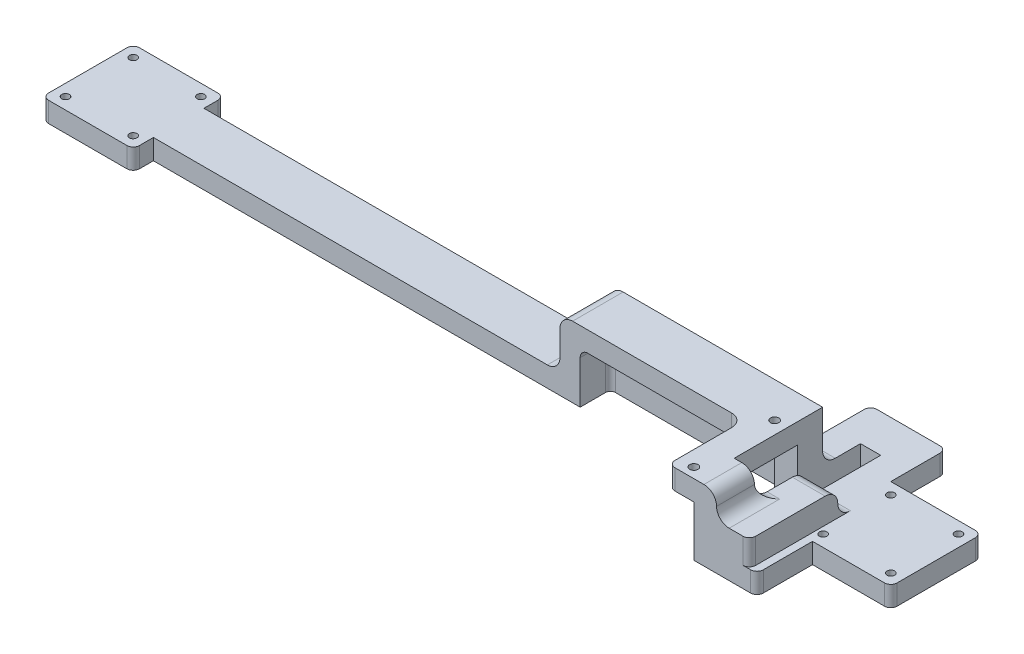
from build123d import *

# Parameters (mm, degrees)
SKETCH1_W            = 70
SKETCH1_H            = 20
SKETCH1_W_2          = 264.8
EXTRUDE_1017_DEPTH   = 8
SKETCH2_W            = 36
SKETCH2_H            = 8
BOSS_EXTRUDE2_DEPTH  = 8
SKETCH4_W            = 36
SKETCH4_H            = 8
BOSS_EXTRUDE3_DEPTH  = 8
SKETCH5_R            = 1.5
CUT_EXTRUDE1_DEPTH   = 349.438631613
FILLET1_R            = 2.5
SKETCH6_W            = 52
SKETCH6_H            = 20
CUT_EXTRUDE2_DEPTH   = 349.438631613
SKETCH7_W            = 16.8
SKETCH7_H            = 20
CUT_EXTRUDE3_DEPTH   = 299.821485171
SKETCH8_W            = 30
SKETCH8_H            = 8
BOSS_EXTRUDE4_DEPTH  = 30
SKETCH9_W            = 30
SKETCH9_H            = 8
BOSS_EXTRUDE5_DEPTH  = 30
SKETCH10_W           = 8
SKETCH10_H           = 50
CUT_EXTRUDE4_DEPTH   = 307.61226329
SKETCH12_W           = 11
SKETCH12_H           = 50
BOSS_EXTRUDE6_DEPTH  = 17
SKETCH13_W           = 8
SKETCH13_H           = 15
BOSS_EXTRUDE7_DEPTH  = 17
SKETCH15_W           = 11
SKETCH15_H           = 45
CUT_EXTRUDE6_DEPTH   = 20
SKETCH16_W           = 22
SKETCH16_H           = 8
BOSS_EXTRUDE9_DEPTH  = 5
SKETCH18_W           = 13
SKETCH18_H           = 40
BOSS_EXTRUDE10_DEPTH = 10
SKETCH21_W           = 13
SKETCH21_H           = 5
CUT_EXTRUDE9_DEPTH   = 10
SKETCH17_W           = 16
SKETCH17_H           = 22
CUT_EXTRUDE7_DEPTH   = 12
SKETCH19_W           = 70
SKETCH19_H           = 20
BOSS_EXTRUDE11_DEPTH = 17
SKETCH20_W           = 65
SKETCH20_H           = 15
CUT_EXTRUDE8_DEPTH   = 20
SKETCH22_W           = 20
SKETCH22_H           = 17
BOSS_EXTRUDE12_DEPTH = 3
BOSS_EXTRUDE13_DEPTH = 3
SKETCH24_R           = 1.65
CUT_EXTRUDE10_DEPTH  = 308.159697877
BOSS_EXTRUDE14_DEPTH = 1
FILLET4_R            = 5
FILLET5_R            = 5
FILLET7_R            = 5
FILLET8_R            = 5
FILLET9_R            = 5
FILLET10_R           = 5
FILLET11_R           = 5
FILLET12_R           = 5
FILLET13_R           = 5
FILLET14_R           = 2.5
FILLET15_R           = 2.5
FILLET16_R           = 2.5
FILLET17_R           = 5
SKETCH26_W           = 76
SKETCH26_H           = 20
BOSS_EXTRUDE15_DEPTH = 3
FILLET18_R           = 3
SKETCH27_W           = 9
SKETCH27_H           = 20
BOSS_EXTRUDE16_DEPTH = 2
FILLET20_R           = 2


with BuildPart() as part:
    # Sketch1 → Extrude 1017 (new body)
    with BuildSketch(Plane(origin=(0, 0, 0), x_dir=(1, 0, 0), z_dir=(0, 1, 0))):
        with Locations((-35, -78.2)):
            Rectangle(SKETCH1_W, SKETCH1_H)
        with Locations((132.4, -78.2)):
            Rectangle(SKETCH1_W_2, SKETCH1_H)
        with Locations((299.8, -78.2)):
            Rectangle(SKETCH1_W, SKETCH1_H)
    extrude(amount=EXTRUDE_1017_DEPTH)

    # Sketch2 → Boss-Extrude2 (add)
    with BuildSketch(Plane(origin=(0, 0, 68.2), x_dir=(-1, 0, 0), z_dir=(0, 0, -1))):
        with Locations((35.2, 4)):
            Rectangle(SKETCH2_W, SKETCH2_H)
        with Locations((-264.8, 4)):
            Rectangle(SKETCH2_W, SKETCH2_H)
    extrude(amount=BOSS_EXTRUDE2_DEPTH)

    # Sketch4 → Boss-Extrude3 (add)
    with BuildSketch(Plane.XY.offset(88.2)):
        with Locations((-35.2, 4)):
            Rectangle(SKETCH4_W, SKETCH4_H)
        with Locations((264.8, 4)):
            Rectangle(SKETCH4_W, SKETCH4_H)
    extrude(amount=BOSS_EXTRUDE3_DEPTH)

    # Sketch5 → Cut-Extrude1 (cut, through all)
    with BuildSketch(Plane(origin=(0, 8, 0), x_dir=(1, 0, 0), z_dir=(0, 1, 0))):
        with Locations(Location((-48.6, -91.6, 0), (0, 0, 270))):
            Circle(SKETCH5_R)
        with Locations(Location((-21.8, -91.6, 0), (0, 0, 270))):
            Circle(SKETCH5_R)
        with Locations(Location((-21.8, -64.8, 0), (0, 0, 270))):
            Circle(SKETCH5_R)
        with Locations(Location((-48.6, -64.8, 0), (0, 0, 270))):
            Circle(SKETCH5_R)
        with Locations(Location((278.2, -91.6, 0), (0, 0, 270))):
            Circle(SKETCH5_R)
        with Locations(Location((251.4, -64.8, 0), (0, 0, 270))):
            Circle(SKETCH5_R)
        with Locations(Location((278.2, -64.8, 0), (0, 0, 270))):
            Circle(SKETCH5_R)
        with Locations(Location((251.4, -91.6, 0), (0, 0, 270))):
            Circle(SKETCH5_R)
    extrude(amount=-CUT_EXTRUDE1_DEPTH, mode=Mode.SUBTRACT)

    # Fillet1
    fillet1_edges = [part.edges().sort_by_distance(p)[0] for p in [
        (-53.2, 4, 60.2),
        (-17.2, 4, 60.2),
        (282.8, 4, 60.2),
        (-17.2, 4, 96.2),
        (-53.2, 4, 96.2),
        (282.8, 4, 96.2),
    ]]
    fillet(fillet1_edges, radius=FILLET1_R)

    # Sketch6 → Cut-Extrude2 (cut, through all)
    with BuildSketch(Plane(origin=(0, 8, 0), x_dir=(1, 0, 0), z_dir=(0, 1, 0))):
        with Locations((308.8, -78.2)):
            Rectangle(SKETCH6_W, SKETCH6_H)
    extrude(amount=-CUT_EXTRUDE2_DEPTH, mode=Mode.SUBTRACT)

    # Sketch7 → Cut-Extrude3 (cut, through all)
    with BuildSketch(Plane(origin=(0, 0, 0), x_dir=(-1, 0, 0), z_dir=(0, -1, 0))):
        with Locations((61.6, -78.2)):
            Rectangle(SKETCH7_W, SKETCH7_H)
    extrude(amount=-CUT_EXTRUDE3_DEPTH, mode=Mode.SUBTRACT)

    # Sketch8 → Boss-Extrude4 (add)
    with BuildSketch(Plane.XY.offset(88.2)):
        with Locations((231.8, 4)):
            Rectangle(SKETCH8_W, SKETCH8_H)
    extrude(amount=BOSS_EXTRUDE4_DEPTH)

    # Sketch9 → Boss-Extrude5 (add)
    with BuildSketch(Plane(origin=(0, 0, 68.2), x_dir=(-1, 0, 0), z_dir=(0, 0, -1))):
        with Locations((-231.8, 4)):
            Rectangle(SKETCH9_W, SKETCH9_H)
    extrude(amount=BOSS_EXTRUDE5_DEPTH)

    # Sketch10 → Cut-Extrude4 (cut, through all)
    with BuildSketch(Plane(origin=(0, 0, 0), x_dir=(-1, 0, 0), z_dir=(0, -1, 0))):
        with Locations((-231.8, -78.2)):
            Rectangle(SKETCH10_W, SKETCH10_H)
    extrude(amount=-CUT_EXTRUDE4_DEPTH, mode=Mode.SUBTRACT)

    # Sketch12 → Boss-Extrude6 (add)
    with BuildSketch(Plane(origin=(0, 8, 0), x_dir=(1, 0, 0), z_dir=(0, 1, 0))):
        with Locations((222.3, -93.2)):
            Rectangle(SKETCH12_W, SKETCH12_H)
    extrude(amount=BOSS_EXTRUDE6_DEPTH)

    # Sketch13 → Boss-Extrude7 (add)
    with BuildSketch(Plane(origin=(0, 8, 0), x_dir=(1, 0, 0), z_dir=(0, 1, 0))):
        with Locations((231.8, -110.7)):
            Rectangle(SKETCH13_W, SKETCH13_H)
    extrude(amount=BOSS_EXTRUDE7_DEPTH)

    # Sketch15 → Cut-Extrude6 (cut)
    with BuildSketch(Plane(origin=(0, 0, 0), x_dir=(-1, 0, 0), z_dir=(0, -1, 0))):
        with Locations((-222.3, -95.7)):
            Rectangle(SKETCH15_W, SKETCH15_H)
    extrude(amount=-CUT_EXTRUDE6_DEPTH, mode=Mode.SUBTRACT)

    # Sketch16 → Boss-Extrude9 (add)
    with BuildSketch(Plane(origin=(246.8, 0, 0), x_dir=(0, 0, -1), z_dir=(1, 0, 0))):
        with Locations((-107.2, 4)):
            Rectangle(SKETCH16_W, SKETCH16_H)
    extrude(amount=BOSS_EXTRUDE9_DEPTH)

    # Sketch18 → Boss-Extrude10 (add)
    with BuildSketch(Plane(origin=(0, 8, 0), x_dir=(1, 0, 0), z_dir=(0, 1, 0))):
        with Locations((242.3, -98.2)):
            Rectangle(SKETCH18_W, SKETCH18_H)
    extrude(amount=BOSS_EXTRUDE10_DEPTH)

    # Sketch21 → Cut-Extrude9 (cut)
    with BuildSketch(Plane(origin=(0, 18, 0), x_dir=(1, 0, 0), z_dir=(0, 1, 0))):
        with Locations((242.3, -80.7)):
            Rectangle(SKETCH21_W, SKETCH21_H)
    extrude(amount=-CUT_EXTRUDE9_DEPTH, mode=Mode.SUBTRACT)

    # Sketch17 → Cut-Extrude7 (cut)
    with BuildSketch(Plane(origin=(0, 0, 0), x_dir=(-1, 0, 0), z_dir=(0, -1, 0))):
        with Locations((-235.8, -99.2)):
            Rectangle(SKETCH17_W, SKETCH17_H)
    extrude(amount=-CUT_EXTRUDE7_DEPTH, mode=Mode.SUBTRACT)

    # Sketch19 → Boss-Extrude11 (add)
    with BuildSketch(Plane(origin=(0, 8, 0), x_dir=(1, 0, 0), z_dir=(0, 1, 0))):
        with Locations((181.8, -78.2)):
            Rectangle(SKETCH19_W, SKETCH19_H)
    extrude(amount=BOSS_EXTRUDE11_DEPTH)

    # Sketch20 → Cut-Extrude8 (cut)
    with BuildSketch(Plane(origin=(0, 0, 0), x_dir=(-1, 0, 0), z_dir=(0, -1, 0))):
        with Locations((-184.3, -80.7)):
            Rectangle(SKETCH20_W, SKETCH20_H)
    extrude(amount=-CUT_EXTRUDE8_DEPTH, mode=Mode.SUBTRACT)

    # Sketch22 → Boss-Extrude12 (add)
    with BuildSketch(Plane.ZY.offset(-146.8)):
        with Locations((78.2, 16.5)):
            Rectangle(SKETCH22_W, SKETCH22_H)
    extrude(amount=BOSS_EXTRUDE12_DEPTH)

    # Sketch23 → Boss-Extrude13 (add)
    with BuildSketch(Plane(origin=(0, 25, 0), x_dir=(1, 0, 0), z_dir=(0, 1, 0))):
        Polygon((143.8, -68.2), (143.8, -88.2), (216.8, -88.2), (216.8, -118.2), (235.8, -118.2), (235.8, -103.2), (227.8, -103.2), (227.8, -68.2), align=None)
    extrude(amount=BOSS_EXTRUDE13_DEPTH)

    # Sketch24 → Cut-Extrude10 (cut, through all)
    with BuildSketch(Plane(origin=(0, 20, 0), x_dir=(-1, 0, 0), z_dir=(0, -1, 0))):
        with Locations(Location((-222.8, -114.2, 0), (0, 0, 90))):
            Circle(SKETCH24_R)
        with Locations(Location((-222.8, -82.2, 0), (0, 0, 90))):
            Circle(SKETCH24_R)
    extrude(amount=-CUT_EXTRUDE10_DEPTH, mode=Mode.SUBTRACT)

    # Sketch25 → Boss-Extrude14 (add)
    with BuildSketch(Plane.ZY.offset(-227.8)):
        Polygon((103.2, 20), (103.2, 12), (110.2, 12), (110.2, 0), (118.2, 0), (118.2, 20), align=None)
    extrude(amount=BOSS_EXTRUDE14_DEPTH)

    # Fillet4
    fillet4_edges = [part.edges().sort_by_distance(p)[0] for p in [
        (143.8, 8, 78.2),
    ]]
    fillet(fillet4_edges, radius=FILLET4_R)

    # Fillet5
    fillet5_edges = [part.edges().sort_by_distance(p)[0] for p in [
        (143.8, 28, 78.2),
    ]]
    fillet(fillet5_edges, radius=FILLET5_R)

    # Fillet7
    fillet7_edges = [part.edges().sort_by_distance(p)[0] for p in [
        (222.3, 8, 68.2),
    ]]
    fillet(fillet7_edges, radius=FILLET7_R)

    # Fillet8
    fillet8_edges = [part.edges().sort_by_distance(p)[0] for p in [
        (235.8, 18, 110.7),
    ]]
    fillet(fillet8_edges, radius=FILLET8_R)

    # Fillet9
    fillet9_edges = [part.edges().sort_by_distance(p)[0] for p in [
        (235.8, 28, 110.7),
    ]]
    fillet(fillet9_edges, radius=FILLET9_R - 0.0001)  # a hair under: the kernel refuses the full size

    # Fillet10
    fillet10_edges = [part.edges().sort_by_distance(p)[0] for p in [
        (216.8, 6.5, 68.2),
    ]]
    fillet(fillet10_edges, radius=FILLET10_R)

    # Fillet11
    fillet11_edges = [part.edges().sort_by_distance(p)[0] for p in [
        (242.3, 8, 83.2),
    ]]
    fillet(fillet11_edges, radius=FILLET11_R)

    # Fillet12
    fillet12_edges = [part.edges().sort_by_distance(p)[0] for p in [
        (242.3, 18, 83.2),
    ]]
    fillet(fillet12_edges, radius=FILLET12_R - 0.0001)  # a hair under: the kernel refuses the full size

    # Fillet13
    fillet13_edges = [part.edges().sort_by_distance(p)[0] for p in [
        (216.8, 24, 88.2),
    ]]
    fillet(fillet13_edges, radius=FILLET13_R)

    # Fillet14
    fillet14_edges = [part.edges().sort_by_distance(p)[0] for p in [
        (246.8, 4, 38.2),
        (216.8, 4, 38.2),
    ]]
    fillet(fillet14_edges, radius=FILLET14_R)

    # Fillet15
    fillet15_edges = [part.edges().sort_by_distance(p)[0] for p in [
        (216.8, 24, 118.2),
        (251.8, 4, 118.2),
    ]]
    fillet(fillet15_edges, radius=FILLET15_R)

    # Fillet16
    fillet16_edges = [part.edges().sort_by_distance(p)[0] for p in [
        (248.8, 13, 118.2),
    ]]
    fillet(fillet16_edges, radius=FILLET16_R)

    # Fillet17
    fillet17_edges = [part.edges().sort_by_distance(p)[0] for p in [
        (238.3, 18, 103.2),
    ]]
    fillet(fillet17_edges, radius=FILLET17_R - 0.0001)  # a hair under: the kernel refuses the full size

    # Sketch26 → Boss-Extrude15 (add)
    with BuildSketch(Plane.XY.offset(73.2)):
        with Locations((189.8, 10)):
            Rectangle(SKETCH26_W, SKETCH26_H)
    extrude(amount=BOSS_EXTRUDE15_DEPTH)

    # Fillet18
    fillet18_edges = [part.edges().sort_by_distance(p)[0] for p in [
        (151.8, 20, 82.2),
    ]]
    fillet(fillet18_edges, radius=FILLET18_R)

    # Sketch27 → Boss-Extrude16 (add)
    with BuildSketch(Plane.XY.offset(76.2)):
        with Locations((223.3, 10)):
            Rectangle(SKETCH27_W, SKETCH27_H)
    extrude(amount=BOSS_EXTRUDE16_DEPTH)

    # Fillet20
    fillet20_edges = [part.edges().sort_by_distance(p)[0] for p in [
        (151.8, 8.5, 76.2),
        (152.678679656, 19.121320344, 76.2),
        (186.8, 20, 76.2),
    ]]
    fillet(fillet20_edges, radius=FILLET20_R)


solid = part.part
